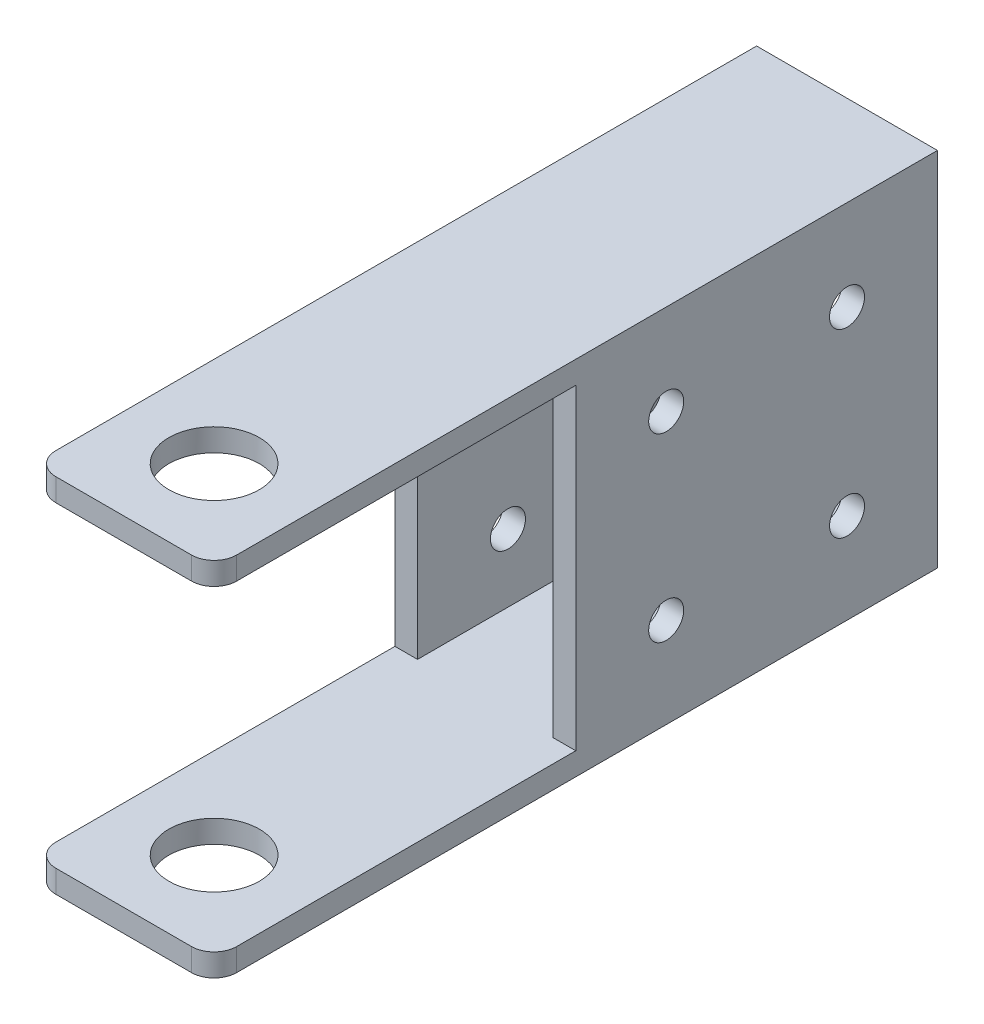
from build123d import *

# Parameters (mm, degrees)
SKETCH2_W                    = 25.4
SKETCH2_H                    = 50.8
BOSS_EXTRUDE1_DEPTH          = 50.8
SKETCH3_W                    = 50.8
SKETCH3_H                    = 44.45
CUT_EXTRUDE1_DEPTH           = 63.217039467
SKETCH4_R                    = 6.35
CUT_EXTRUDE2_DEPTH           = 73.955945611
F_10_0_1935_DIAMETER_HOLE2_D = 4.9149
SKETCH9_W                    = 19.05
SKETCH9_H                    = 44.45
CUT_EXTRUDE3_DEPTH           = 106.494123059
FILLET1_R                    = 3.175


with BuildPart() as part:
    # Sketch2 → Boss-Extrude1 (new, symmetric)
    with BuildSketch(Plane.XY):
        Rectangle(SKETCH2_W, SKETCH2_H)
    extrude(amount=BOSS_EXTRUDE1_DEPTH, both=True)

    # Sketch3 → Cut-Extrude1 (cut, through all)
    with BuildSketch(Plane(origin=(12.7, 0, 0), x_dir=(0, 0, -1), z_dir=(1, 0, 0))):
        with Locations((-25.4, 0)):
            Rectangle(SKETCH3_W, SKETCH3_H)
    extrude(amount=-CUT_EXTRUDE1_DEPTH, mode=Mode.SUBTRACT)

    # Sketch4 → Cut-Extrude2 (cut, through all)
    with BuildSketch(Plane(origin=(0, 25.4, 0), x_dir=(1, 0, 0), z_dir=(0, 1, 0))):
        with Locations((0, -38.1)):
            Circle(SKETCH4_R)
    extrude(amount=-CUT_EXTRUDE2_DEPTH, mode=Mode.SUBTRACT)

    # #10 (0.1935) Diameter Hole2 (through all)
    with Locations(Plane(origin=(12.7, 0, 0), x_dir=(0, 0, -1), z_dir=(1, 0, 0))):
        with Locations((12.7, 12.7), (38.1, 12.7), (12.7, -12.7), (38.1, -12.7)):
            Hole(F_10_0_1935_DIAMETER_HOLE2_D / 2)

    # Sketch9 → Cut-Extrude3 (cut, through all)
    with BuildSketch(Plane(origin=(0, 0, -50.8), x_dir=(-1, 0, 0), z_dir=(0, 0, -1))):
        Rectangle(SKETCH9_W, SKETCH9_H)
    extrude(amount=-CUT_EXTRUDE3_DEPTH, mode=Mode.SUBTRACT)

    # Fillet1
    fillet1_edges = [part.edges().sort_by_distance(p)[0] for p in [
        (-12.7, 23.8125, 50.8),
        (-12.7, -23.8125, 50.8),
        (12.7, 23.8125, 50.8),
        (12.7, -23.8125, 50.8),
    ]]
    fillet(fillet1_edges, radius=FILLET1_R)


solid = part.part
